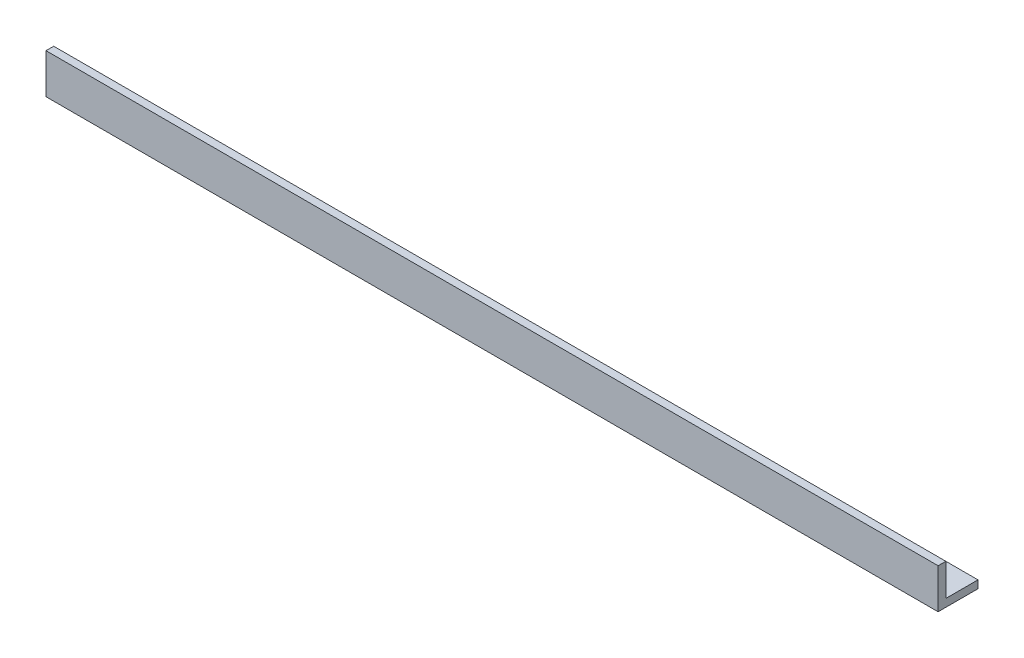
from build123d import *

# Parameters (mm, degrees)
BOSS_EXTRUDE1_DEPTH = 426


with BuildPart() as part:
    # Sketch1 → Boss-Extrude1 (new body)
    with BuildSketch(Plane(origin=(0, 0, 0), x_dir=(0, 0, -1), z_dir=(1, 0, 0))):
        Polygon((0, 0), (0, 19.05), (3.684988132, 19.05), (3.684988132, 3.684988132), (19.05, 3.684988132), (19.05, 0), align=None)
    extrude(amount=BOSS_EXTRUDE1_DEPTH)


solid = part.part
